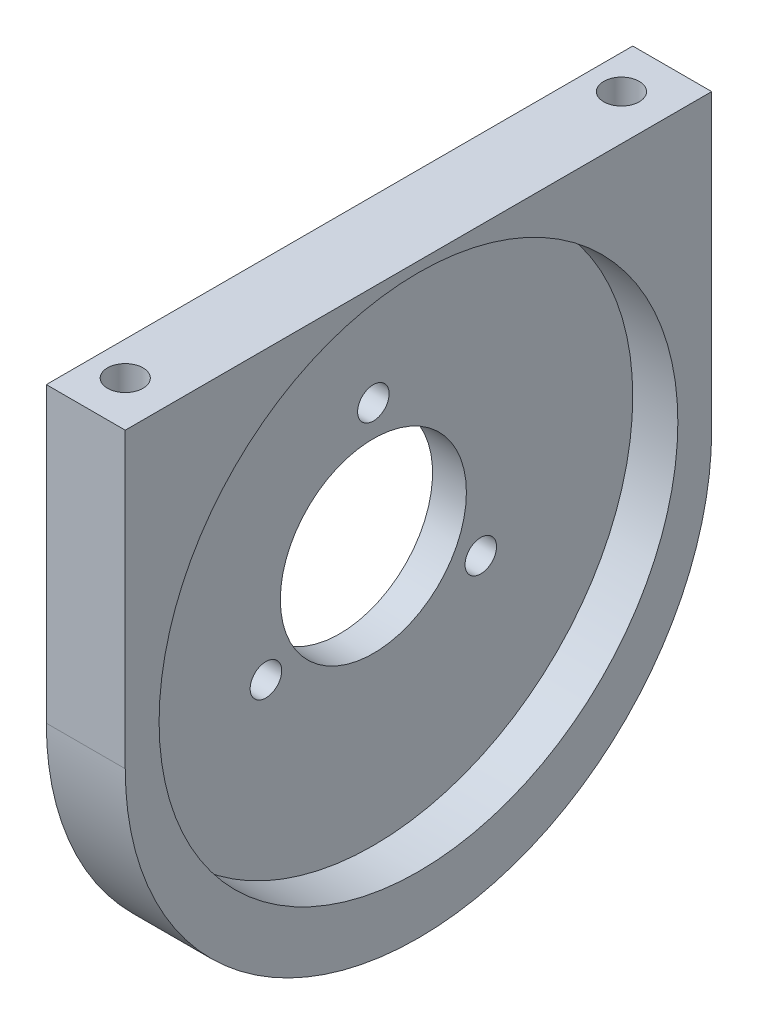
from build123d import *

# Parameters (mm, degrees)
ESBO_O1_W                                            = 52
ESBO_O1_H                                            = 52
RESSALTO_EXTRUS_O1_DEPTH                             = 7
ESBO_O2_R                                            = 8.25
CORTE_EXTRUS_O1_DEPTH                                = 74.87151007
ESCAREADO_PARA_PARAFUSO_DE_M_QUINA_COM_C_D           = 2.794
ESCAREADO_PARA_PARAFUSO_DE_M_QUINA_COM_C_CSINK_D     = 5.0546
ESCAREADO_PARA_PARAFUSO_DE_M_QUINA_COM_C_CSINK_ANGLE = 100
PADR_OCIRCULAR1_COUNT                                = 3
ESBO_O27_R                                           = 23
CORTE_EXTRUS_O5_DEPTH                                = 4
FILETE1_R                                            = 26
FURO_ROSCADO_PARA_CONDU_TE_DE_M3X0_51_D              = 3.15
FURO_ROSCADO_PARA_CONDU_TE_DE_M3X0_51_DEPTH          = 10
FURO_ROSCADO_PARA_CONDU_TE_DE_M3X0_51_TIP            = 0.946355475


with BuildPart() as part:
    # Esboço1 → Ressalto-extrusão1 (new body)
    with BuildSketch(Plane(origin=(0, 0, 0), x_dir=(0, 0, -1), z_dir=(1, 0, 0))):
        with Locations((26, 26)):
            Rectangle(ESBO_O1_W, ESBO_O1_H)
    extrude(amount=RESSALTO_EXTRUS_O1_DEPTH)

    # Esboço2 → Corte-extrusão1 (cut, through all)
    with BuildSketch(Plane.ZY):
        with Locations((-26, 28.1)):
            Circle(ESBO_O2_R)
    extrude(amount=-CORTE_EXTRUS_O1_DEPTH, mode=Mode.SUBTRACT)

    # Escareado para parafuso de máquina com cabeça chata (100) de #32 (through all)
    with Locations(Plane.ZY):
        with Locations((-26, 39.1)):
            escareado_para_parafuso_de_m_quina_com_c = CounterSinkHole(ESCAREADO_PARA_PARAFUSO_DE_M_QUINA_COM_C_D / 2, ESCAREADO_PARA_PARAFUSO_DE_M_QUINA_COM_C_CSINK_D / 2, counter_sink_angle=ESCAREADO_PARA_PARAFUSO_DE_M_QUINA_COM_C_CSINK_ANGLE)

    # PadrãoCircular1: Escareado para parafuso de máquina com cabeça chata (100) de #32 ×3 about axis
    padr_ocircular1_axis = Axis((0, 28.1, -26), (1, 0, 0))
    for i in range(1, PADR_OCIRCULAR1_COUNT):
        add(escareado_para_parafuso_de_m_quina_com_c.rotate(padr_ocircular1_axis, i * 360 / PADR_OCIRCULAR1_COUNT), mode=Mode.SUBTRACT)

    # Esboço27 → Corte-extrusão5 (cut)
    with BuildSketch(Plane(origin=(7, 0, 0), x_dir=(0, 0, -1), z_dir=(1, 0, 0))):
        with Locations((26, 28.1)):
            Circle(ESBO_O27_R)
    extrude(amount=-CORTE_EXTRUS_O5_DEPTH, mode=Mode.SUBTRACT)

    # Filete1
    filete1_edges = [part.edges().sort_by_distance(p)[0] for p in [
        (3.5, 0, -52),
        (3.5, 0, 0),
    ]]
    fillet(filete1_edges, radius=FILETE1_R - 0.0001)  # a hair under: the kernel refuses the full size

    # Furo roscado para conduíte de M3x0.51
    with Locations(Plane(origin=(0, 52, 0), x_dir=(1, 0, 0), z_dir=(0, 1, 0))):
        with Locations((3, 48), (3, 4)):
            Hole(FURO_ROSCADO_PARA_CONDU_TE_DE_M3X0_51_D / 2, depth=FURO_ROSCADO_PARA_CONDU_TE_DE_M3X0_51_DEPTH)
            with Locations((0, 0, -(FURO_ROSCADO_PARA_CONDU_TE_DE_M3X0_51_DEPTH + FURO_ROSCADO_PARA_CONDU_TE_DE_M3X0_51_TIP / 2))):  # 118° drill point
                Cone(0, FURO_ROSCADO_PARA_CONDU_TE_DE_M3X0_51_D / 2, FURO_ROSCADO_PARA_CONDU_TE_DE_M3X0_51_TIP, mode=Mode.SUBTRACT)


solid = part.part
